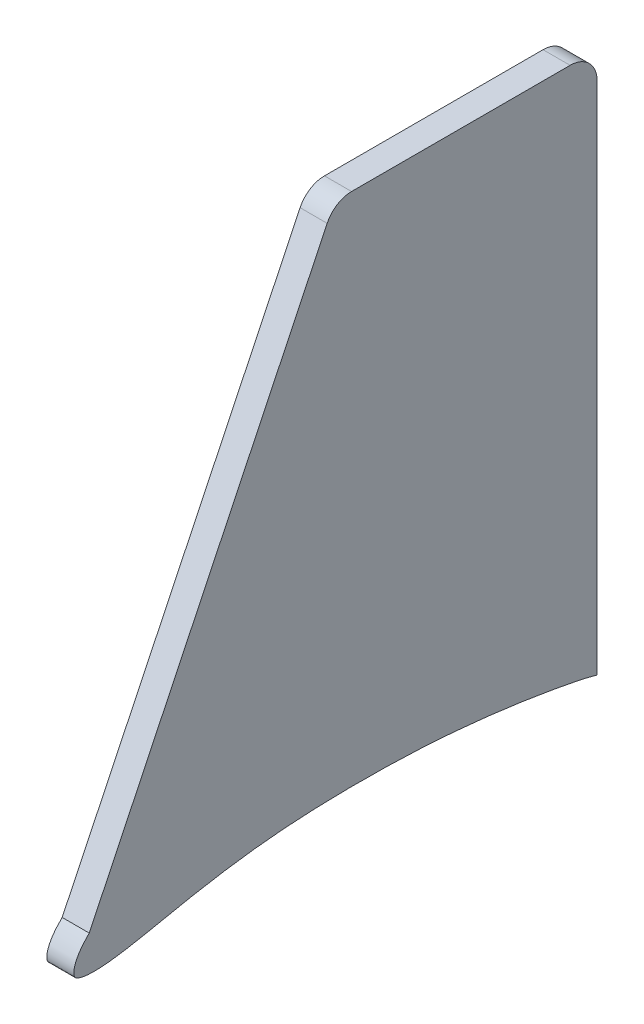
from build123d import *

# Parameters (mm, degrees)
BOSS_EXTRUDE1_DEPTH = 10
FILLET1_R           = 10
FILLET2_R           = 10


with BuildPart() as part:
    # Sketch4 → Boss-Extrude1 (new body)
    with BuildSketch(Plane(origin=(0, 0, 0), x_dir=(0, 0, -1), z_dir=(1, 0, 0))):
        with BuildLine():
            add(Edge.make_bspline(
                [(-187.591289537, 11.268146798), (-187.910759487, 10.96376416), (-189.053363989, 9.83010396), (-190.750303118, 7.849430297), (-192.319447204, 5.292227114), (-193.121118694, 3.085900933), (-193.299910313, 1.559966185), (-193.217116114, 0.756976121), (-193.135168354, 0.364638659), (-193.047057743, 0.109527208), (-192.96639442, -0.080081172), (-192.894481628, -0.209169578), (-192.813199569, -0.32939945), (-192.711052749, -0.435970861), (-192.594950194, -0.53605079), (-192.418624979, -0.673000911), (-192.159205485, -0.827368923), (-191.743541908, -1.032510896), (-191.230986193, -1.226991107), (-189.878130351, -1.634363638), (-187.356289931, -1.931101096), (-183.363397329, -1.906833463), (-178.337477564, -1.414618093), (-172.251379163, -0.457528265), (-165.04477977, 0.971756922), (-156.672519985, 2.748116294), (-147.132421676, 4.613088792), (-136.538925287, 6.392036957), (-125.088731717, 7.921740474), (-113.043379816, 8.990800612), (-100.71648472, 9.557336848), (-88.385603015, 9.740389553), (-76.255706097, 9.588388175), (-64.510387484, 9.120060905), (-53.344960285, 8.338472651), (-42.948017549, 7.31262327), (-33.476260533, 6.153614235), (-25.038527154, 4.940692714), (-17.75658571, 3.75104804), (-11.611443602, 2.629162446), (-6.909030546, 1.71287727), (-3.100978366, 0.815909006), (-1.51759987, 0.474452698), (6.3484e-05, -0.019060108), (4.5473e-05, 0.000407463), (0, 0.000636824)],
                knots=[0.485936785, 0.485936785, 0.485936785, 0.485936785, 0.48920359, 0.497850586, 0.505193934, 0.511308341, 0.515097163, 0.516441428, 0.517272652, 0.518060388, 0.518436362, 0.518797413, 0.519153544, 0.519507976, 0.519886846, 0.520288641, 0.521160208, 0.522116283, 0.523720315, 0.52521352, 0.532574604, 0.542380648, 0.554776211, 0.56993128, 0.588004893, 0.609187965, 0.63332852, 0.660001247, 0.688743434, 0.718873444, 0.749542513, 0.780126844, 0.81020899, 0.839387288, 0.867183376, 0.893104481, 0.916760447, 0.937874173, 0.956198632, 0.971543675, 0.983762849, 0.992691516, 0.998158824, 1, 1.000020304, 1.000020304, 1.000020304, 1.000020304], degree=3))
            Line((0, 0.000636824), (0, 200))
            Line((0, 200), (-97, 200))
            Line((-97, 200), (-187.591289537, 11.268146798))
        make_face()
    extrude(amount=BOSS_EXTRUDE1_DEPTH)

    # Fillet1
    fillet1_edges = [part.edges().sort_by_distance(p)[0] for p in [
        (5, 200, 97),
    ]]
    fillet(fillet1_edges, radius=FILLET1_R)

    # Fillet2
    fillet2_edges = [part.edges().sort_by_distance(p)[0] for p in [
        (5, 200, 0),
    ]]
    fillet(fillet2_edges, radius=FILLET2_R)


solid = part.part
